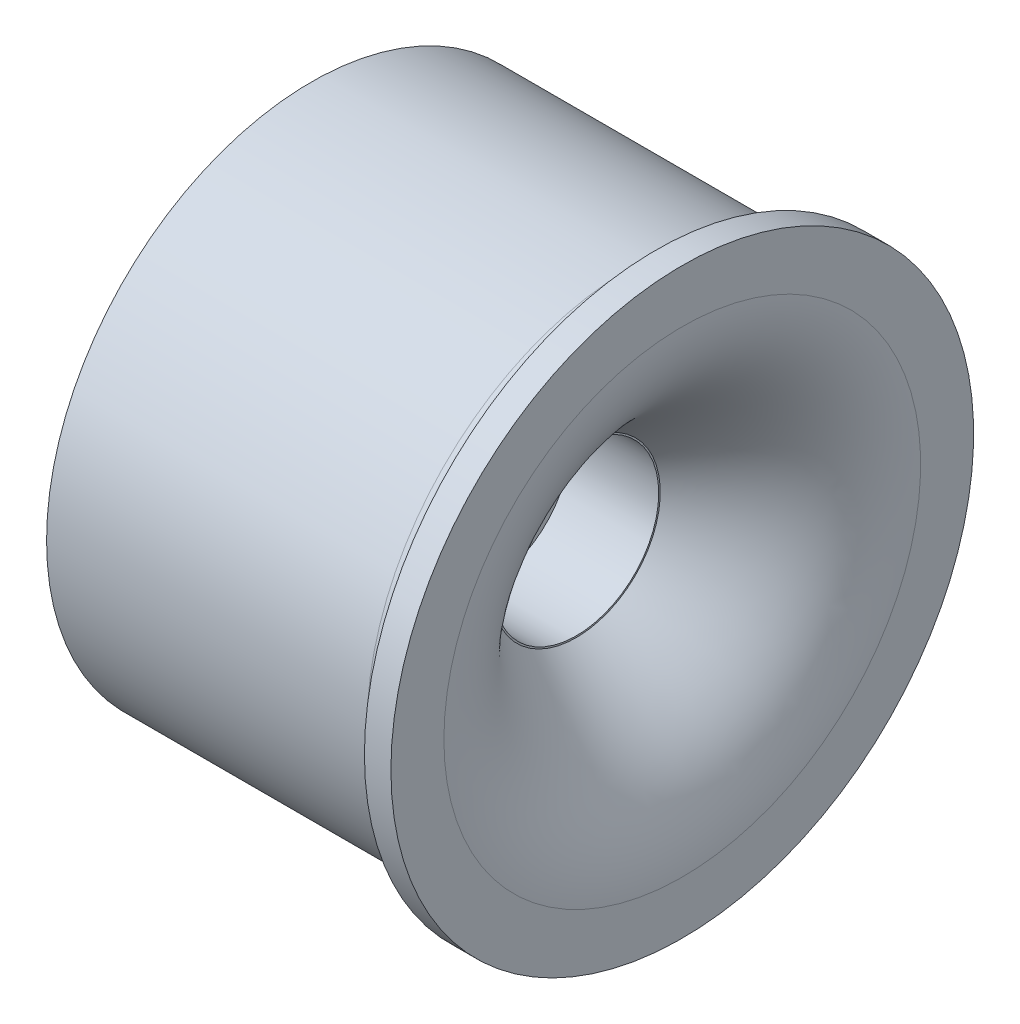
from build123d import *
from OCP.BRepAlgoAPI import BRepAlgoAPI_Cut
from OCP.TopTools import TopTools_ListOfShape

# Parameters (mm, degrees)
SKETCH2_R           = 5.5
SKETCH2_R_2         = 1
BOSS_EXTRUDE1_DEPTH = 10
SCALE1_SCALE        = 0.9
SKETCH3_R           = 2.8
CUT_EXTRUDE1_DEPTH  = 3
SKETCH4_R           = 1.42
CUT_EXTRUDE2_DEPTH  = 7
SKETCH6_R           = 12.614646558
SKETCH6_R_2         = 9
CUT_EXTRUDE3_DEPTH  = 10


with BuildPart() as part:
    # Sketch1 → Revolve1 (revolve)
    with BuildSketch(Plane.XY):
        with BuildLine():
            Line((-7, 9), (5, 9))
            add(Edge.make_bspline(
                [(5, 9), (5, 8.856466181), (4.980630385, 8.552638111), (4.879856885, 8.085906437), (4.637540593, 7.528306389), (3.996049584, 6.69016035), (2.86097235, 5.618747783), (1.478465211, 4.503997435), (0.514957064, 3.794701588), (0.068439653, 3.476275963), (0, 3.427716912)],
                knots=[0, 0, 0, 0, 0.0625, 0.125, 0.25, 0.375, 0.5, 0.625, 0.75, 0.773497894, 0.773497894, 0.773497894, 0.773497894], degree=3))
            Line((0, 3.427716912), (0, 1))
            add(Edge.make_bspline(
                [(7, 9), (7, 7.437991686), (5.451200792, 4.581787455), (0.00160793, 1.001387392), (0, 1)],
                knots=[0, 0, 0, 0, 0.405901642, 1, 1, 1, 1], degree=3))
            Line((7, 9), (7, 11))
            Line((7, 11), (6, 11))
            Line((6, 11), (6, 10.9))
            ThreePointArc((6, 10.9), (5.736396103, 10.263603897), (5.1, 10))
            Line((5.1, 10), (-5.1, 10))
            ThreePointArc((-5.1, 10), (-5.736396103, 10.263603897), (-6, 10.9))
            Line((-6, 10.9), (-6, 11))
            Line((-6, 11), (-7, 11))
            Line((-7, 11), (-7, 9))
        make_face()
    revolve(axis=Axis((0, 0, 0), (1, 0, 0)))

    # Sketch2 → Boss-Extrude1 (add)
    with BuildSketch(Plane.ZY.offset(7)):
        Circle(SKETCH2_R)
        Circle(SKETCH2_R_2, mode=Mode.SUBTRACT)
    extrude(amount=-BOSS_EXTRUDE1_DEPTH)


with BuildPart() as part_1:
    # Scale1: scaled about (0.211743453, 1.2736e-05, 1.291e-06)
    add(part.part.scale(SCALE1_SCALE).moved(Location((0.021174345, 1.274e-06, 1.29e-07))))

    # Sketch3 → Cut-Extrude1 (cut)
    with BuildSketch(Plane(origin=(2.721175281, 0, 0), x_dir=(0, 0, -1), z_dir=(1, 0, 0))):
        Circle(SKETCH3_R)
    extrude(amount=-CUT_EXTRUDE1_DEPTH, mode=Mode.SUBTRACT)


with BuildPart() as cut_extrude2_tool:
    # Sketch4 → Cut-Extrude2 (new body)
    with BuildSketch(Plane.ZY.offset(6.278824719)):
        with Locations((-8.53e-07, 0)):
            Circle(SKETCH4_R)
    extrude(amount=-CUT_EXTRUDE2_DEPTH)


with BuildPart() as part_2:
    add(part_1.part)

    # Cut-Extrude2: cut by cut_extrude2_tool, with a tolerance
    cut_extrude2_stock = TopTools_ListOfShape()
    cut_extrude2_stock.Append(part_2.part.wrapped)
    cut_extrude2_tools = TopTools_ListOfShape()
    cut_extrude2_tools.Append(cut_extrude2_tool.part.wrapped)
    cut_extrude2_cut = BRepAlgoAPI_Cut()
    cut_extrude2_cut.SetArguments(cut_extrude2_stock)
    cut_extrude2_cut.SetTools(cut_extrude2_tools)
    cut_extrude2_cut.SetFuzzyValue(0.00001)
    cut_extrude2_cut.Build()
    add(Compound.cast(cut_extrude2_cut.Shape()).solids(), mode=Mode.REPLACE)


with BuildPart() as cut_extrude3_tool:
    # Sketch6 → Cut-Extrude3 (new body)
    with BuildSketch(Plane(origin=(0, 0, 0), x_dir=(0, 0, -1), z_dir=(1, 0, 0))):
        with Locations((8.53e-07, 0)):
            Circle(SKETCH6_R)
        with Locations((8.53e-07, 0)):
            Circle(SKETCH6_R_2, mode=Mode.SUBTRACT)
    extrude(amount=-CUT_EXTRUDE3_DEPTH)


with BuildPart() as part_3:
    add(part_2.part)

    # Cut-Extrude3: cut by cut_extrude3_tool, with a tolerance
    cut_extrude3_stock = TopTools_ListOfShape()
    cut_extrude3_stock.Append(part_3.part.wrapped)
    cut_extrude3_tools = TopTools_ListOfShape()
    cut_extrude3_tools.Append(cut_extrude3_tool.part.wrapped)
    cut_extrude3_cut = BRepAlgoAPI_Cut()
    cut_extrude3_cut.SetArguments(cut_extrude3_stock)
    cut_extrude3_cut.SetTools(cut_extrude3_tools)
    cut_extrude3_cut.SetFuzzyValue(0.00001)
    cut_extrude3_cut.Build()
    add(Compound.cast(cut_extrude3_cut.Shape()).solids(), mode=Mode.REPLACE)


solid = part_3.part
